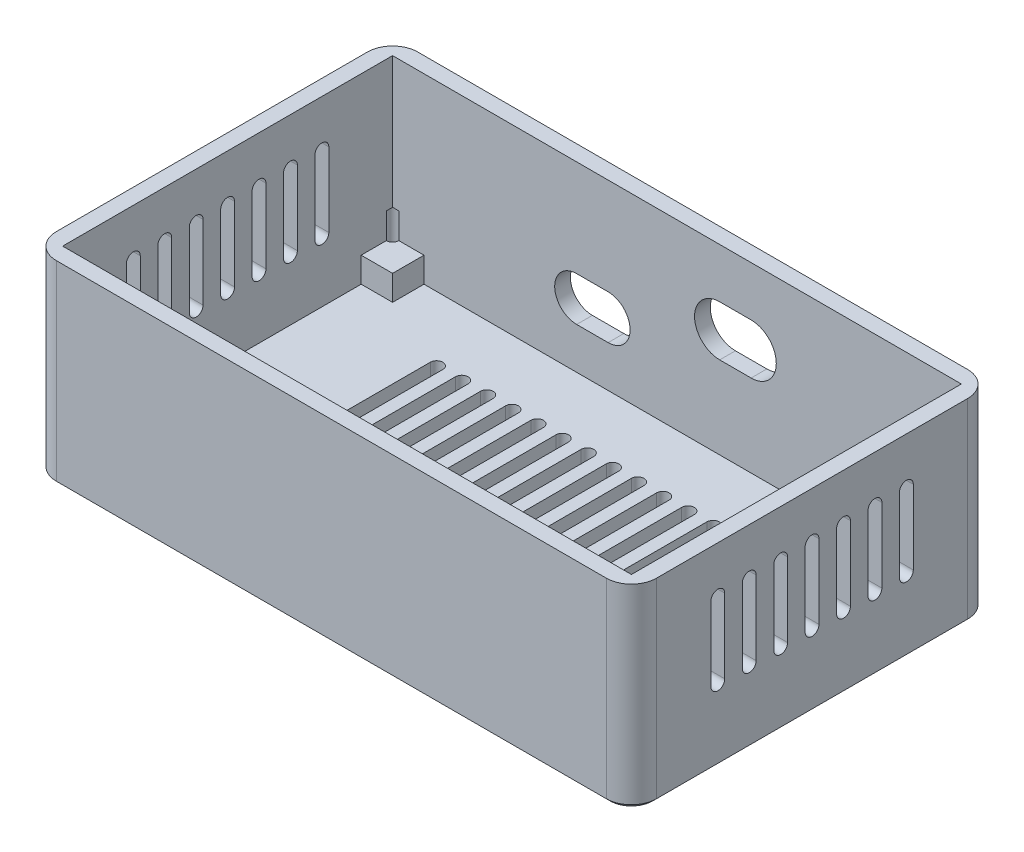
from build123d import *

# Parameters (mm, degrees)
CUERPO_DEPTH                  = 31
CROQUIS_HUECO_PCB_W           = 90.5
CROQUIS_HUECO_PCB_H           = 52.5
HUECO_PCB_DEPTH               = 29
CROQUIS_APOYOS_W              = 5
CROQUIS_APOYOS_H              = 5
APOYOS_PCB_DEPTH              = 4
CROQUIS_ALIVIOS_R             = 1
ALIVIOS_ESQUINAS_DEPTH        = 8.1
SALIDAS_USB_Y_PANEL_DEPTH     = 64.777935056
VENTILAS_LATERALES_DEPTH      = 64.777935056
VENTILAS_LATERALES_DEPTH_BACK = 64.777935056
REJILLA_PISO_DEPTH            = 2
CHAFLAN_BASE_SIZE             = 0.6


with BuildPart() as part:
    # Croquis_contorno → Cuerpo (new body)
    with BuildSketch(Plane(origin=(0, 0, 0), x_dir=(1, 0, 0), z_dir=(0, 1, 0))):
        with BuildLine():
            Line((-43.75, -28.75), (43.75, -28.75))
            ThreePointArc((43.75, -28.75), (46.578427125, -27.578427125), (47.75, -24.75))
            Line((47.75, -24.75), (47.75, 24.75))
            ThreePointArc((47.75, 24.75), (46.578427125, 27.578427125), (43.75, 28.75))
            Line((43.75, 28.75), (-43.75, 28.75))
            ThreePointArc((-43.75, 28.75), (-46.578427125, 27.578427125), (-47.75, 24.75))
            Line((-47.75, 24.75), (-47.75, -24.75))
            ThreePointArc((-47.75, -24.75), (-46.578427125, -27.578427125), (-43.75, -28.75))
        make_face()
    extrude(amount=CUERPO_DEPTH)

    # Croquis_hueco_PCB → Hueco_PCB (cut)
    with BuildSketch(Plane(origin=(0, 31, 0), x_dir=(1, 0, 0), z_dir=(0, 1, 0))):
        Rectangle(CROQUIS_HUECO_PCB_W, CROQUIS_HUECO_PCB_H)
    extrude(amount=-HUECO_PCB_DEPTH, mode=Mode.SUBTRACT)

    # Croquis_apoyos → Apoyos_PCB (add)
    with BuildSketch(Plane(origin=(0, 2, 0), x_dir=(1, 0, 0), z_dir=(0, 1, 0))):
        with Locations((-42.75, -23.75)):
            Rectangle(CROQUIS_APOYOS_W, CROQUIS_APOYOS_H)
        with Locations((-42.75, 23.75)):
            Rectangle(CROQUIS_APOYOS_W, CROQUIS_APOYOS_H)
        with Locations((42.75, -23.75)):
            Rectangle(CROQUIS_APOYOS_W, CROQUIS_APOYOS_H)
        with Locations((42.75, 23.75)):
            Rectangle(CROQUIS_APOYOS_W, CROQUIS_APOYOS_H)
    extrude(amount=APOYOS_PCB_DEPTH)

    # Croquis_alivios → Alivios_esquinas (cut)
    with BuildSketch(Plane(origin=(0, 2, 0), x_dir=(1, 0, 0), z_dir=(0, 1, 0))):
        with Locations((-45.25, -26.25)):
            Circle(CROQUIS_ALIVIOS_R)
        with Locations((-45.25, 26.25)):
            Circle(CROQUIS_ALIVIOS_R)
        with Locations((45.25, -26.25)):
            Circle(CROQUIS_ALIVIOS_R)
        with Locations((45.25, 26.25)):
            Circle(CROQUIS_ALIVIOS_R)
    extrude(amount=ALIVIOS_ESQUINAS_DEPTH, mode=Mode.SUBTRACT)

    # Croquis_salidas → Salidas_USB_y_panel (cut, through all)
    with BuildSketch(Plane.XY):
        with BuildLine():
            Line((6.8, 23.1), (11.8, 23.1))
            ThreePointArc((11.8, 23.1), (15.8, 19.1), (11.8, 15.1))
            Line((11.8, 15.1), (6.8, 15.1))
            ThreePointArc((6.8, 15.1), (2.8, 19.1), (6.8, 23.1))
        make_face()
        with BuildLine():
            Line((-15.96, 15.6), (-10.96, 15.6))
            ThreePointArc((-10.96, 15.6), (-7.46, 12.1), (-10.96, 8.6))
            Line((-10.96, 8.6), (-15.96, 8.6))
            ThreePointArc((-15.96, 8.6), (-19.46, 12.1), (-15.96, 15.6))
        make_face()
    extrude(amount=-SALIDAS_USB_Y_PANEL_DEPTH, mode=Mode.SUBTRACT)

    # Croquis_ventilas → Ventilas_laterales (cut, two sides: drawn at the far end of the back side and taken through both)
    with BuildSketch(Plane(origin=(0, 0, 0), x_dir=(0, 0, -1), z_dir=(1, 0, 0)).offset(-VENTILAS_LATERALES_DEPTH_BACK)):
        with BuildLine():
            Line((-16.1, 11.7), (-16.1, 23.5))
            ThreePointArc((-16.1, 23.5), (-15, 24.6), (-13.9, 23.5))
            Line((-13.9, 23.5), (-13.9, 11.7))
            ThreePointArc((-13.9, 11.7), (-15, 10.6), (-16.1, 11.7))
        make_face()
        with BuildLine():
            Line((-11.1, 11.7), (-11.1, 23.5))
            ThreePointArc((-11.1, 23.5), (-10, 24.6), (-8.9, 23.5))
            Line((-8.9, 23.5), (-8.9, 11.7))
            ThreePointArc((-8.9, 11.7), (-10, 10.6), (-11.1, 11.7))
        make_face()
        with BuildLine():
            Line((-6.1, 11.7), (-6.1, 23.5))
            ThreePointArc((-6.1, 23.5), (-5, 24.6), (-3.9, 23.5))
            Line((-3.9, 23.5), (-3.9, 11.7))
            ThreePointArc((-3.9, 11.7), (-5, 10.6), (-6.1, 11.7))
        make_face()
        with BuildLine():
            Line((-1.1, 11.7), (-1.1, 23.5))
            ThreePointArc((-1.1, 23.5), (0, 24.6), (1.1, 23.5))
            Line((1.1, 23.5), (1.1, 11.7))
            ThreePointArc((1.1, 11.7), (0, 10.6), (-1.1, 11.7))
        make_face()
        with BuildLine():
            Line((3.9, 11.7), (3.9, 23.5))
            ThreePointArc((3.9, 23.5), (5, 24.6), (6.1, 23.5))
            Line((6.1, 23.5), (6.1, 11.7))
            ThreePointArc((6.1, 11.7), (5, 10.6), (3.9, 11.7))
        make_face()
        with BuildLine():
            Line((8.9, 11.7), (8.9, 23.5))
            ThreePointArc((8.9, 23.5), (10, 24.6), (11.1, 23.5))
            Line((11.1, 23.5), (11.1, 11.7))
            ThreePointArc((11.1, 11.7), (10, 10.6), (8.9, 11.7))
        make_face()
        with BuildLine():
            Line((13.9, 11.7), (13.9, 23.5))
            ThreePointArc((13.9, 23.5), (15, 24.6), (16.1, 23.5))
            Line((16.1, 23.5), (16.1, 11.7))
            ThreePointArc((16.1, 11.7), (15, 10.6), (13.9, 11.7))
        make_face()
    extrude(amount=VENTILAS_LATERALES_DEPTH + VENTILAS_LATERALES_DEPTH_BACK, mode=Mode.SUBTRACT)

    # Croquis_rejilla_piso → Rejilla_piso (cut)
    with BuildSketch(Plane(origin=(0, 0, 0), x_dir=(1, 0, 0), z_dir=(0, 1, 0))):
        with BuildLine():
            Line((-29, -16), (-29, 16))
            ThreePointArc((-29, 16), (-28, 17), (-27, 16))
            Line((-27, 16), (-27, -16))
            ThreePointArc((-27, -16), (-28, -17), (-29, -16))
        make_face()
        with BuildLine():
            Line((-25, -16), (-25, 16))
            ThreePointArc((-25, 16), (-24, 17), (-23, 16))
            Line((-23, 16), (-23, -16))
            ThreePointArc((-23, -16), (-24, -17), (-25, -16))
        make_face()
        with BuildLine():
            Line((-21, -16), (-21, 16))
            ThreePointArc((-21, 16), (-20, 17), (-19, 16))
            Line((-19, 16), (-19, -16))
            ThreePointArc((-19, -16), (-20, -17), (-21, -16))
        make_face()
        with BuildLine():
            Line((-17, -16), (-17, 16))
            ThreePointArc((-17, 16), (-16, 17), (-15, 16))
            Line((-15, 16), (-15, -16))
            ThreePointArc((-15, -16), (-16, -17), (-17, -16))
        make_face()
        with BuildLine():
            Line((-13, -16), (-13, 16))
            ThreePointArc((-13, 16), (-12, 17), (-11, 16))
            Line((-11, 16), (-11, -16))
            ThreePointArc((-11, -16), (-12, -17), (-13, -16))
        make_face()
        with BuildLine():
            Line((-9, -16), (-9, 16))
            ThreePointArc((-9, 16), (-8, 17), (-7, 16))
            Line((-7, 16), (-7, -16))
            ThreePointArc((-7, -16), (-8, -17), (-9, -16))
        make_face()
        with BuildLine():
            Line((-5, -16), (-5, 16))
            ThreePointArc((-5, 16), (-4, 17), (-3, 16))
            Line((-3, 16), (-3, -16))
            ThreePointArc((-3, -16), (-4, -17), (-5, -16))
        make_face()
        with BuildLine():
            Line((-1, -16), (-1, 16))
            ThreePointArc((-1, 16), (0, 17), (1, 16))
            Line((1, 16), (1, -16))
            ThreePointArc((1, -16), (0, -17), (-1, -16))
        make_face()
        with BuildLine():
            Line((3, -16), (3, 16))
            ThreePointArc((3, 16), (4, 17), (5, 16))
            Line((5, 16), (5, -16))
            ThreePointArc((5, -16), (4, -17), (3, -16))
        make_face()
        with BuildLine():
            Line((7, -16), (7, 16))
            ThreePointArc((7, 16), (8, 17), (9, 16))
            Line((9, 16), (9, -16))
            ThreePointArc((9, -16), (8, -17), (7, -16))
        make_face()
        with BuildLine():
            Line((11, -16), (11, 16))
            ThreePointArc((11, 16), (12, 17), (13, 16))
            Line((13, 16), (13, -16))
            ThreePointArc((13, -16), (12, -17), (11, -16))
        make_face()
        with BuildLine():
            Line((15, -16), (15, 16))
            ThreePointArc((15, 16), (16, 17), (17, 16))
            Line((17, 16), (17, -16))
            ThreePointArc((17, -16), (16, -17), (15, -16))
        make_face()
        with BuildLine():
            Line((19, -16), (19, 16))
            ThreePointArc((19, 16), (20, 17), (21, 16))
            Line((21, 16), (21, -16))
            ThreePointArc((21, -16), (20, -17), (19, -16))
        make_face()
        with BuildLine():
            Line((23, -16), (23, 16))
            ThreePointArc((23, 16), (24, 17), (25, 16))
            Line((25, 16), (25, -16))
            ThreePointArc((25, -16), (24, -17), (23, -16))
        make_face()
        with BuildLine():
            Line((27, -16), (27, 16))
            ThreePointArc((27, 16), (28, 17), (29, 16))
            Line((29, 16), (29, -16))
            ThreePointArc((29, -16), (28, -17), (27, -16))
        make_face()
    extrude(amount=REJILLA_PISO_DEPTH, mode=Mode.SUBTRACT)

    # Chaflan_base
    chaflan_base_edges = [part.edges().sort_by_distance(p)[0] for p in [
        (0, 0, 28.75),
        (46.578427125, 0, 27.578427125),
        (47.75, 0, 0),
        (46.578427125, 0, -27.578427125),
        (0, 0, -28.75),
        (-46.578427125, 0, -27.578427125),
        (-47.75, 0, 0),
        (-46.578427125, 0, 27.578427125),
    ]]
    chamfer(chaflan_base_edges, length=CHAFLAN_BASE_SIZE)


solid = part.part
